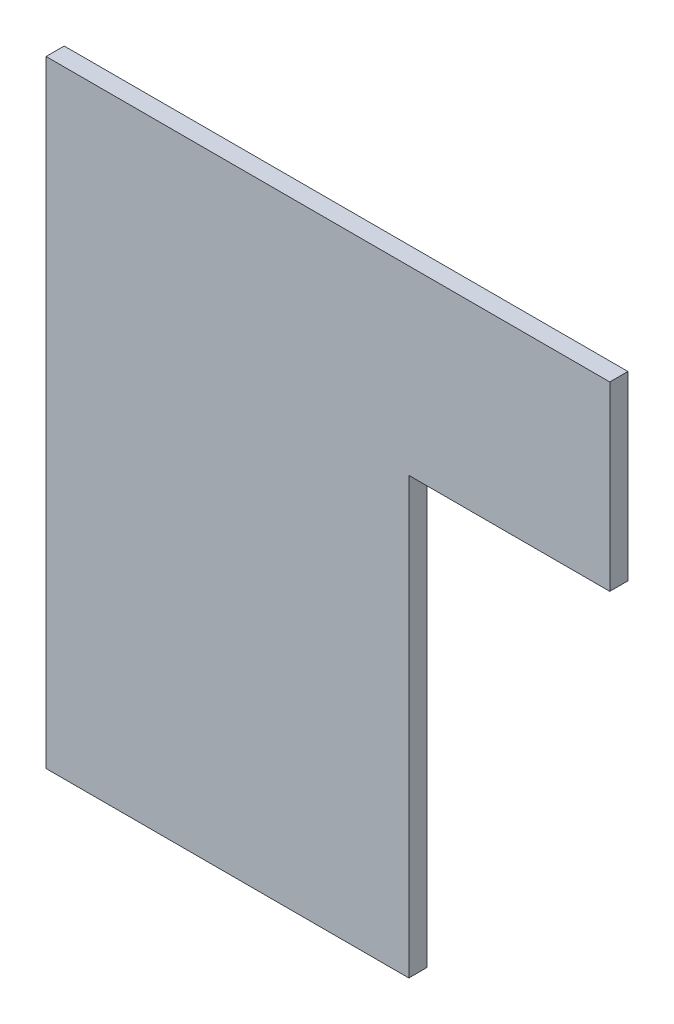
from build123d import *

# Parameters (mm, degrees)
BOSS_EXTRUDE1_DEPTH = 3.175


with BuildPart() as part:
    # Sketch1 → Boss-Extrude1 (new body)
    with BuildSketch(Plane.XY):
        Polygon((0, 0), (63.5, 0), (63.5, 76.2), (98.679, 76.2), (98.679, 107.95), (63.5, 107.95), (0, 107.95), align=None)
    extrude(amount=BOSS_EXTRUDE1_DEPTH)


solid = part.part
